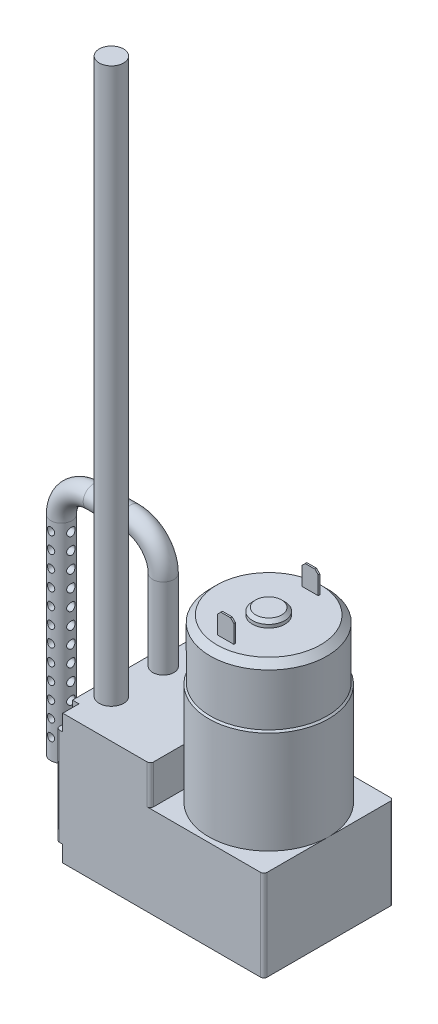
from build123d import *

# Parameters (mm, degrees)
SKETCH1_W           = 64
SKETCH1_H           = 40
BOSS_EXTRUDE1_DEPTH = 40
SKETCH2_W           = 35
SKETCH2_H           = 40
CUT_EXTRUDE1_DEPTH  = 12
SKETCH3_R           = 19
CUT_EXTRUDE2_DEPTH  = 47.989360498
SKETCH4_R           = 18.5
BOSS_EXTRUDE2_DEPTH = 30
SKETCH5_R           = 18
BOSS_EXTRUDE3_DEPTH = 20
CHAMFER1_SIZE       = 2
SKETCH6_W           = 5
SKETCH6_H           = 0.5
BOSS_EXTRUDE4_DEPTH = 6.6
CHAMFER2_SIZE       = 1
SKETCH7_R           = 2.5
BOSS_EXTRUDE5_DEPTH = 12
CHAMFER3_SIZE       = 1
CUT_EXTRUDE3_DEPTH  = 0.1
FILLET1_R           = 1
SKETCH10_R          = 5
BOSS_EXTRUDE6_DEPTH = 2
CHAMFER4_SIZE       = 1
CUT_EXTRUDE4_DEPTH  = 2
SKETCH15_R          = 3.286672259
SKETCH16_R          = 3.286672259
BOSS_EXTRUDE7_DEPTH = 12
SKETCH17_R          = 1.14252497
CUT_EXTRUDE5_DEPTH  = 12
SKETCH18_R          = 1.253035582
CUT_EXTRUDE6_DEPTH  = 12
SKETCH19_R          = 3.761966274
BOSS_EXTRUDE8_DEPTH = 171


with BuildPart() as part:
    # Sketch1 → Boss-Extrude1 (new body)
    with BuildSketch(Plane(origin=(0, 0, 0), x_dir=(1, 0, 0), z_dir=(0, 1, 0))):
        Rectangle(SKETCH1_W, SKETCH1_H)
    extrude(amount=BOSS_EXTRUDE1_DEPTH)

    # Sketch2 → Cut-Extrude1 (cut)
    with BuildSketch(Plane(origin=(0, 40, 0), x_dir=(1, 0, 0), z_dir=(0, 1, 0))):
        with Locations((14.5, 0)):
            Rectangle(SKETCH2_W, SKETCH2_H)
    extrude(amount=-CUT_EXTRUDE1_DEPTH, mode=Mode.SUBTRACT)

    # Sketch3 → Cut-Extrude2 (cut, through all)
    with BuildSketch(Plane(origin=(0, 28, 0), x_dir=(1, 0, 0), z_dir=(0, 1, 0))):
        with Locations((13.5, 0)):
            Circle(SKETCH3_R)
    extrude(amount=CUT_EXTRUDE2_DEPTH, mode=Mode.SUBTRACT)

    # Sketch4 → Boss-Extrude2 (add)
    with BuildSketch(Plane(origin=(0, 28, 0), x_dir=(1, 0, 0), z_dir=(0, 1, 0))):
        with Locations((13.5, 0)):
            Circle(SKETCH4_R)
    extrude(amount=BOSS_EXTRUDE2_DEPTH)

    # Sketch5 → Boss-Extrude3 (add)
    with BuildSketch(Plane(origin=(0, 58, 0), x_dir=(1, 0, 0), z_dir=(0, 1, 0))):
        with Locations(Location((13.5, 0, 0), (0, 0, 270))):
            Circle(SKETCH5_R)
    extrude(amount=BOSS_EXTRUDE3_DEPTH)

    # Chamfer1
    # the kernel refuses this chamfer: 2 mm, written as the material it adds along each edge
    with BuildSketch(Plane(origin=(13.5, 58, 0), x_dir=(0, 0, 1), z_dir=(-1, 0, 0))) as chamfer1_piece_1_section:
        Polygon((18 + CHAMFER1_SIZE, 0), (18, CHAMFER1_SIZE), (18, 0), align=None)
    chamfer1_piece_1 = revolve(axis=Axis((13.5, 58, 0), (0, 1, 0)), mode=Mode.PRIVATE)
    chamfer1_piece_1 = chamfer1_piece_1 & Plane(origin=(13.5, 59.744029813, 0), x_dir=(1, 0, 0), z_dir=(0, -1, 0)) * Cylinder(18.5, 80, mode=Mode.PRIVATE)
    add(chamfer1_piece_1)
    # the kernel refuses this chamfer: 2 mm, written as the material it takes off along each edge
    with BuildSketch(Plane(origin=(13.5, 78, 0), x_dir=(0, 0, 1), z_dir=(-1, 0, 0))) as chamfer1_2_piece_1:
        Polygon((18, -CHAMFER1_SIZE), (18 - CHAMFER1_SIZE, 0), (18, 0), align=None)
    revolve(axis=Axis((13.5, 78, 0), (0, 1, 0)), mode=Mode.SUBTRACT)

    # Sketch6 → Boss-Extrude4 (add)
    with BuildSketch(Plane(origin=(0, 78, 0), x_dir=(1, 0, 0), z_dir=(0, 1, 0))):
        with Locations((13.5, 13)):
            Rectangle(SKETCH6_W, SKETCH6_H)
        with Locations((13.5, -13)):
            Rectangle(SKETCH6_W, SKETCH6_H)
    extrude(amount=BOSS_EXTRUDE4_DEPTH)

    # Chamfer2
    chamfer2_edges = [part.edges().sort_by_distance(p)[0] for p in [
        (16, 84.6, -13),
        (11, 84.6, -13),
        (16, 84.6, 13),
        (11, 84.6, 13),
    ]]
    chamfer(chamfer2_edges, length=CHAMFER2_SIZE)

    # Sketch7 → Boss-Extrude5 (add)
    with BuildSketch(Plane(origin=(0, 40, 0), x_dir=(1, 0, 0), z_dir=(0, 1, 0))):
        with Locations(Location((-27, 8, 0), (0, 0, 270))):
            Circle(SKETCH7_R)
        with Locations(Location((-27, -8, 0), (0, 0, 270))):
            Circle(SKETCH7_R)
    extrude(amount=BOSS_EXTRUDE5_DEPTH)

    # Chamfer3
    chamfer3_edges = [part.edges().sort_by_distance(p)[0] for p in [
        (-27, 52, -10.5),
        (-27, 52, 5.5),
    ]]
    chamfer(chamfer3_edges, length=CHAMFER3_SIZE)

    # Sketch9 → Cut-Extrude3 (cut)
    with BuildSketch(Plane.ZY.offset(32)):
        Polygon((-5, 33), (-8, 30), (-11, 33), (-9, 33), (-9, 37), (-7, 37), (-7, 33), align=None)
        Polygon((9, 30), (9, 34), (11, 34), (8, 37), (5, 34), (7, 34), (7, 30), align=None)
    extrude(amount=-CUT_EXTRUDE3_DEPTH, mode=Mode.SUBTRACT)

    # Fillet1
    fillet1_edges = [part.edges().sort_by_distance(p)[0] for p in [
        (32, 14, 20),
        (32, 14, -20),
        (-3, 34, 20),
        (-3, 34, -20),
        (-3, 34, -9.420721841),
        (-3, 34, 9.420721841),
        (-32, 20, 20),
        (-32, 20, -20),
    ]]
    fillet(fillet1_edges, radius=FILLET1_R)

    # Sketch10 → Boss-Extrude6 (add)
    with BuildSketch(Plane(origin=(0, 78, 0), x_dir=(1, 0, 0), z_dir=(0, 1, 0))):
        with Locations(Location((13.5, 0, 0), (0, 0, 270))):
            Circle(SKETCH10_R)
    extrude(amount=BOSS_EXTRUDE6_DEPTH)

    # Chamfer4
    chamfer4_edges = [part.edges().sort_by_distance(p)[0] for p in [
        (13.5, 80, -5),
    ]]
    chamfer(chamfer4_edges, length=CHAMFER4_SIZE)

    # Sketch13 → Cut-Extrude4 (cut)
    with BuildSketch(Plane.ZY.offset(32)):
        with BuildLine():
            Line((-20, 40), (-15, 40))
            Line((-15, 40), (-15, 37))
            ThreePointArc((-15, 37), (-15.585786438, 35.585786438), (-17, 35))
            Line((-17, 35), (-20, 35))
            Line((-20, 35), (-20, 40))
        make_face()
        with BuildLine():
            Line((20, 40), (15, 40))
            Line((15, 40), (15, 37))
            ThreePointArc((15, 37), (15.585786438, 35.585786438), (17, 35))
            Line((17, 35), (20, 35))
            Line((20, 35), (20, 40))
        make_face()
        with BuildLine():
            Line((-20, 0), (-15, 0))
            Line((-15, 0), (-15, 3))
            ThreePointArc((-15, 3), (-15.585786438, 4.414213562), (-17, 5))
            Line((-17, 5), (-20, 5))
            Line((-20, 5), (-20, 0))
        make_face()
        with BuildLine():
            Line((20, 0), (15, 0))
            Line((15, 0), (15, 3))
            ThreePointArc((15, 3), (15.585786438, 4.414213562), (17, 5))
            Line((17, 5), (20, 5))
            Line((20, 5), (20, 0))
        make_face()
    extrude(amount=-CUT_EXTRUDE4_DEPTH, mode=Mode.SUBTRACT)

    # Sweep1: sweep along a curve in space
    with BuildLine() as sweep1_path:
        Line((-27, 52, -8), (-27, 64.854755578, -8))
        ThreePointArc((-27, 64.854755578, -8), (-29.928932188, 71.925823389, -8), (-37, 74.854755578, -8))
        Line((-37, 74.854755578, -8), (-48.413560365, 74.854755578, -8))
        ThreePointArc((-48.413560365, 74.854755578, -8), (-55.484628176, 71.925823389, -8), (-58.413560365, 64.854755578, -8))
        Line((-58.413560365, 64.854755578, -8), (-58.413560365, 0.743022552, -8))
    # Sketch15 → Sweep1 (sweep)
    with BuildSketch(Plane(origin=(0, 52, 0), x_dir=(1, 0, 0), z_dir=(0, 1, 0))):
        with Locations((-27, 8)):
            Circle(SKETCH15_R)
    sweep(path=sweep1_path.line)

    # Sketch16 → Boss-Extrude7 (add)
    with BuildSketch(Plane.XZ.offset(-52)):
        with Locations(Location((-27, -8, 0), (0, 0, 90))):
            Circle(SKETCH16_R)
    extrude(amount=BOSS_EXTRUDE7_DEPTH)

    # Sketch17 → Cut-Extrude5 (cut)
    with BuildSketch(Plane.XY):
        with Locations((-58.494570151, 62.008555726)):
            Circle(SKETCH17_R)
        with Locations((-58.494570151, 57.008555726)):
            Circle(SKETCH17_R)
        with Locations((-58.494570151, 52.008555726)):
            Circle(SKETCH17_R)
        with Locations((-58.494570151, 47.008555726)):
            Circle(SKETCH17_R)
        with Locations((-58.494570151, 42.008555726)):
            Circle(SKETCH17_R)
        with Locations((-58.494570151, 37.008555726)):
            Circle(SKETCH17_R)
        with Locations((-58.494570151, 32.008555726)):
            Circle(SKETCH17_R)
        with Locations((-58.494570151, 27.008555726)):
            Circle(SKETCH17_R)
        with Locations((-58.494570151, 22.008555726)):
            Circle(SKETCH17_R)
        with Locations((-58.494570151, 17.008555726)):
            Circle(SKETCH17_R)
        with Locations((-58.494570151, 12.008555726)):
            Circle(SKETCH17_R)
        with Locations((-58.494570151, 7.008555726)):
            Circle(SKETCH17_R)
    extrude(amount=-CUT_EXTRUDE5_DEPTH, mode=Mode.SUBTRACT)

    # Sketch18 → Cut-Extrude6 (cut)
    with BuildSketch(Plane(origin=(-50, 0, 0), x_dir=(0, 0, -1), z_dir=(1, 0, 0))):
        with Locations((7.879955299, 61.933198606)):
            Circle(SKETCH18_R)
        with Locations((7.879955299, 56.933198606)):
            Circle(SKETCH18_R)
        with Locations((7.879955299, 51.933198606)):
            Circle(SKETCH18_R)
        with Locations((7.879955299, 46.933198606)):
            Circle(SKETCH18_R)
        with Locations((7.879955299, 41.933198606)):
            Circle(SKETCH18_R)
        with Locations((7.879955299, 36.933198606)):
            Circle(SKETCH18_R)
        with Locations((7.879955299, 31.933198606)):
            Circle(SKETCH18_R)
        with Locations((7.879955299, 26.933198606)):
            Circle(SKETCH18_R)
        with Locations((7.879955299, 21.933198606)):
            Circle(SKETCH18_R)
        with Locations((7.879955299, 16.933198606)):
            Circle(SKETCH18_R)
        with Locations((7.879955299, 11.933198606)):
            Circle(SKETCH18_R)
        with Locations((7.879955299, 6.933198606)):
            Circle(SKETCH18_R)
    extrude(amount=-CUT_EXTRUDE6_DEPTH, mode=Mode.SUBTRACT)

    # Sketch19 → Boss-Extrude8 (add)
    with BuildSketch(Plane(origin=(0, 40, 0), x_dir=(1, 0, 0), z_dir=(0, 1, 0))):
        with Locations(Location((-27, -8, 0), (0, 0, 270))):
            Circle(SKETCH19_R)
    extrude(amount=BOSS_EXTRUDE8_DEPTH)


solid = part.part
